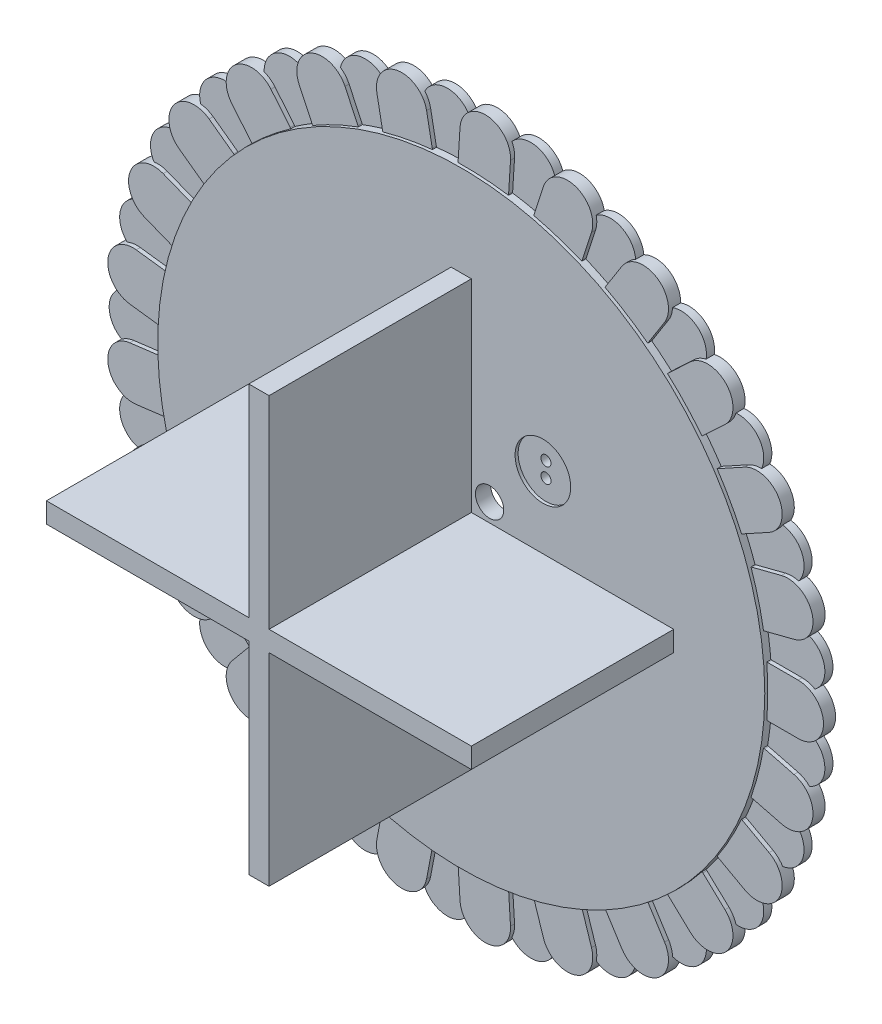
from build123d import *

# Parameters (mm, degrees)
SCHIZZO1_R                   = 30
ESTRUSIONE_ESTRUSIONE1_DEPTH = 1.5
ESTRUSIONE_ESTRUSIONE2_DEPTH = 20
SCHIZZO3_R                   = 0.5
TAGLIO_ESTRUSIONE1_DEPTH     = 47.904157598
SCHIZZO4_R                   = 2.75
TAGLIO_ESTRUSIONE2_DEPTH     = 0.3
ESTRUSIONE_ESTRUSIONE3_DEPTH = 0.8
ESTRUSIONE_ESTRUSIONE4_DEPTH = 1.2
SCHIZZO6_R                   = 1.4
TAGLIO_ESTRUSIONE3_DEPTH     = 54.998896887


with BuildPart() as part:
    # Schizzo1 → Estrusione-Estrusione1 (new body)
    with BuildSketch(Plane.XY):
        Circle(SCHIZZO1_R)
    extrude(amount=ESTRUSIONE_ESTRUSIONE1_DEPTH)

    # Schizzo2 → Estrusione-Estrusione2 (add)
    with BuildSketch(Plane.XY.offset(1.5)):
        Polygon((-1, 1), (-1, 21), (1, 21), (1, 1), (21, 1), (21, -1), (1, -1), (1, -21), (-1, -21), (-1, -1), (-21, -1), (-21, 1), align=None)
    extrude(amount=ESTRUSIONE_ESTRUSIONE2_DEPTH)

    # Schizzo3 → Taglio-Estrusione1 (cut, through all)
    with BuildSketch(Plane.XY.offset(1.5)):
        with Locations((-8.071067812, 8.821067812)):
            Circle(SCHIZZO3_R)
        with Locations((-8.071067812, 7.321067812)):
            Circle(SCHIZZO3_R)
        with Locations((-8.071067812, -8.821067812)):
            Circle(SCHIZZO3_R)
        with Locations((-8.071067812, -7.321067812)):
            Circle(SCHIZZO3_R)
        with Locations((8.071067812, -8.821067812)):
            Circle(SCHIZZO3_R)
        with Locations((8.071067812, -7.321067812)):
            Circle(SCHIZZO3_R)
        with Locations((8.071067812, 8.821067812)):
            Circle(SCHIZZO3_R)
        with Locations((8.071067812, 7.321067812)):
            Circle(SCHIZZO3_R)
    extrude(amount=-TAGLIO_ESTRUSIONE1_DEPTH, mode=Mode.SUBTRACT)

    # Schizzo4 → Taglio-Estrusione2 (cut)
    with BuildSketch(Plane.XY.offset(1.5)):
        with Locations((-8.071067812, -8.071067812)):
            Circle(SCHIZZO4_R)
        with Locations((8.071067812, -8.071067812)):
            Circle(SCHIZZO4_R)
        with Locations((8.071067812, 8.071067812)):
            Circle(SCHIZZO4_R)
        with Locations((-8.071067812, 8.071067812)):
            Circle(SCHIZZO4_R)
    extrude(amount=-TAGLIO_ESTRUSIONE2_DEPTH, mode=Mode.SUBTRACT)

    # Schizzo5 → Estrusione-Estrusione3 (add)
    with BuildSketch(Plane(origin=(0, 0, 0), x_dir=(-1, 0, 0), z_dir=(0, 0, -1))):
        with BuildLine():
            ThreePointArc((-29.895833333, -2.497828918), (-29.947905355, -2.499457171), (-30, -2.5))
            Line((-30, -2.5), (-33, -2.5))
            ThreePointArc((-33, -2.5), (-33.655910107, -2.41242242), (-34.265865799, -2.155825545))
            ThreePointArc((-34.265865799, -2.155825545), (-35.220071897, -4.449329792), (-33.725472626, -6.433477978))
            ThreePointArc((-33.725472626, -6.433477978), (-33.198492862, -6.033252754), (-32.584969035, -5.785308374))
            Line((-32.584969035, -5.785308374), (-29.679219552, -5.039238712))
            ThreePointArc((-29.679219552, -5.039238712), (-29.62862656, -5.026809076), (-29.577785546, -5.015436389))
            ThreePointArc((-29.577785546, -5.015436389), (-29.763441039, -3.759997007), (-29.895833333, -2.497828918))
        make_face()
        with BuildLine():
            ThreePointArc((-33.725472626, 6.433477978), (-35.220071897, 4.449329792), (-34.265865799, 2.155825545))
            ThreePointArc((-34.265865799, 2.155825545), (-33.655910107, 2.41242242), (-33, 2.5))
            Line((-33, 2.5), (-30, 2.5))
            ThreePointArc((-30, 2.5), (-29.947905355, 2.499457171), (-29.895833333, 2.497828918))
            ThreePointArc((-29.895833333, 2.497828918), (-29.763441039, 3.759997007), (-29.577785546, 5.015436389))
            ThreePointArc((-29.577785546, 5.015436389), (-29.62862656, 5.026809076), (-29.679219552, 5.039238712))
            Line((-29.679219552, 5.039238712), (-32.584969035, 5.785308374))
            ThreePointArc((-32.584969035, 5.785308374), (-33.198492862, 6.033252754), (-33.725472626, 6.433477978))
        make_face()
        with BuildLine():
            ThreePointArc((-31.341519599, -10.628224179), (-31.998602743, -10.70651622), (-32.653208603, -10.60967062))
            ThreePointArc((-32.653208603, -10.60967062), (-33.007065249, -13.06842162), (-31.065983974, -14.618542419))
            ThreePointArc((-31.065983974, -14.618542419), (-30.655092214, -14.099836468), (-30.122504627, -13.707104545))
            Line((-30.122504627, -13.707104545), (-27.493584587, -12.261843523))
            ThreePointArc((-27.493584587, -12.261843523), (-27.447672191, -12.237222421), (-27.401256714, -12.213563382))
            ThreePointArc((-27.401256714, -12.213563382), (-27.893294577, -11.043736581), (-28.335415963, -9.854146448))
            ThreePointArc((-28.335415963, -9.854146448), (-28.385447116, -9.868673331), (-28.435770116, -9.882154518))
            Line((-28.435770116, -9.882154518), (-31.341519599, -10.628224179))
        make_face()
        with BuildLine():
            ThreePointArc((-31.065983974, 14.618542419), (-33.007065249, 13.06842162), (-32.653208603, 10.60967062))
            ThreePointArc((-32.653208603, 10.60967062), (-31.998602743, 10.70651622), (-31.341519599, 10.628224179))
            Line((-31.341519599, 10.628224179), (-28.435770116, 9.882154518))
            ThreePointArc((-28.435770116, 9.882154518), (-28.385447116, 9.868673331), (-28.335415963, 9.854146448))
            ThreePointArc((-28.335415963, 9.854146448), (-27.893294577, 11.043736581), (-27.401256714, 12.213563382))
            ThreePointArc((-27.401256714, 12.213563382), (-27.447672191, 12.237222421), (-27.493584587, 12.261843523))
            Line((-27.493584587, 12.261843523), (-30.122504627, 13.707104545))
            ThreePointArc((-30.122504627, 13.707104545), (-30.655092214, 14.099836468), (-31.065983974, 14.618542419))
        make_face()
        with BuildLine():
            ThreePointArc((-27.713736256, -18.088637945), (-28.330705486, -18.327880231), (-28.98883022, -18.396871071))
            ThreePointArc((-28.98883022, -18.396871071), (-28.7201033, -20.866376456), (-26.454505296, -21.885070076))
            ThreePointArc((-26.454505296, -21.885070076), (-26.185519381, -21.280475601), (-25.76733247, -20.767632927))
            Line((-25.76733247, -20.767632927), (-23.580426587, -18.713991609))
            ThreePointArc((-23.580426587, -18.713991609), (-23.542079634, -18.678726077), (-23.503006148, -18.644267269))
            ThreePointArc((-23.503006148, -18.644267269), (-24.270509831, -17.633557569), (-24.994580197, -16.591291715))
            ThreePointArc((-24.994580197, -16.591291715), (-25.039426841, -16.617804452), (-25.084816216, -16.643376923))
            Line((-25.084816216, -16.643376923), (-27.713736256, -18.088637945))
        make_face()
        with BuildLine():
            ThreePointArc((-26.454505296, 21.885070076), (-28.7201033, 20.866376456), (-28.98883022, 18.396871071))
            ThreePointArc((-28.98883022, 18.396871071), (-28.330705486, 18.327880231), (-27.713736256, 18.088637945))
            Line((-27.713736256, 18.088637945), (-25.084816216, 16.643376923))
            ThreePointArc((-25.084816216, 16.643376923), (-25.039426841, 16.617804452), (-24.994580197, 16.591291715))
            ThreePointArc((-24.994580197, 16.591291715), (-24.270509831, 17.633557569), (-23.503006148, 18.644267269))
            ThreePointArc((-23.503006148, 18.644267269), (-23.542079634, 18.678726077), (-23.580426587, 18.713991609))
            Line((-23.580426587, 18.713991609), (-25.76733247, 20.767632927))
            ThreePointArc((-25.76733247, 20.767632927), (-26.185519381, 21.280475601), (-26.454505296, 21.885070076))
        make_face()
        with BuildLine():
            ThreePointArc((-22.34459694, -24.412476064), (-22.88268581, -24.797636121), (-23.502977021, -25.028128453))
            ThreePointArc((-23.502977021, -25.028128453), (-22.628551636, -27.353220119), (-20.180792758, -27.776478293))
            ThreePointArc((-20.180792758, -27.776478293), (-20.070614062, -27.123984189), (-19.793104048, -26.523254554))
            Line((-19.793104048, -26.523254554), (-18.185623663, -23.990270778))
            ThreePointArc((-18.185623663, -23.990270778), (-18.157251631, -23.946576677), (-18.127975267, -23.903483276))
            ThreePointArc((-18.127975267, -23.903483276), (-19.122719692, -23.115397283), (-20.083243033, -22.285945106))
            ThreePointArc((-20.083243033, -22.285945106), (-20.120087288, -22.322777803), (-20.157691058, -22.358834746))
            Line((-20.157691058, -22.358834746), (-22.34459694, -24.412476064))
        make_face()
        with BuildLine():
            ThreePointArc((-20.180792758, 27.776478293), (-22.628551636, 27.353220119), (-23.502977021, 25.028128453))
            ThreePointArc((-23.502977021, 25.028128453), (-22.88268581, 24.797636121), (-22.34459694, 24.412476064))
            Line((-22.34459694, 24.412476064), (-20.157691058, 22.358834746))
            ThreePointArc((-20.157691058, 22.358834746), (-20.120087288, 22.322777803), (-20.083243033, 22.285945106))
            ThreePointArc((-20.083243033, 22.285945106), (-19.122719692, 23.115397283), (-18.127975267, 23.903483276))
            ThreePointArc((-18.127975267, 23.903483276), (-18.157251631, 23.946576677), (-18.185623663, 23.990270778))
            Line((-18.185623663, 23.990270778), (-19.793104048, 26.523254554))
            ThreePointArc((-19.793104048, 26.523254554), (-20.070614062, 27.123984189), (-20.180792758, 27.776478293))
        make_face()
        with BuildLine():
            ThreePointArc((-15.571464421, -29.202388529), (-15.996862828, -29.709265335), (-16.540345338, -30.086776478))
            ThreePointArc((-16.540345338, -30.086776478), (-15.115164851, -32.121360363), (-12.639046791, -31.922588224))
            ThreePointArc((-12.639046791, -31.922588224), (-12.694598247, -31.263193094), (-12.575202105, -30.612322552))
            Line((-12.575202105, -30.612322552), (-11.648151122, -27.759153003))
            ThreePointArc((-11.648151122, -27.759153003), (-11.63153673, -27.709775795), (-11.61389703, -27.660755517))
            ThreePointArc((-11.61389703, -27.660755517), (-12.773378747, -27.144811574), (-13.910001849, -26.580290603))
            ThreePointArc((-13.910001849, -26.580290603), (-13.936528655, -26.625128927), (-13.963984036, -26.669404753))
            Line((-13.963984036, -26.669404753), (-15.571464421, -29.202388529))
        make_face()
        with BuildLine():
            ThreePointArc((-12.639046791, 31.922588224), (-15.115164851, 32.121360363), (-16.540345338, 30.086776478))
            ThreePointArc((-16.540345338, 30.086776478), (-15.996862828, 29.709265335), (-15.571464421, 29.202388529))
            Line((-15.571464421, 29.202388529), (-13.963984036, 26.669404753))
            ThreePointArc((-13.963984036, 26.669404753), (-13.936528655, 26.625128927), (-13.910001849, 26.580290603))
            ThreePointArc((-13.910001849, 26.580290603), (-12.773378747, 27.144811574), (-11.61389703, 27.660755517))
            ThreePointArc((-11.61389703, 27.660755517), (-11.63153673, 27.709775795), (-11.648151122, 27.759153003))
            Line((-11.648151122, 27.759153003), (-12.575202105, 30.612322552))
            ThreePointArc((-12.575202105, 30.612322552), (-12.694598247, 31.263193094), (-12.639046791, 31.922588224))
        make_face()
        with BuildLine():
            ThreePointArc((-7.819919524, -32.157407524), (-8.105898122, -32.754152145), (-8.538422926, -33.254961685))
            ThreePointArc((-8.538422926, -33.254961685), (-6.652036668, -34.871197401), (-4.303143031, -34.062884534))
            ThreePointArc((-4.303143031, -34.062884534), (-4.520934136, -33.4380206), (-4.567153966, -32.777905739))
            Line((-4.567153966, -32.777905739), (-4.378782407, -29.783825554))
            ThreePointArc((-4.378782407, -29.783825554), (-4.374969599, -29.731867791), (-4.37007493, -29.68000076))
            ThreePointArc((-4.37007493, -29.68000076), (-5.621439438, -29.468617522), (-6.862744092, -29.204498687))
            ThreePointArc((-6.862744092, -29.204498687), (-6.877286671, -29.25452528), (-6.892868541, -29.304237975))
            Line((-6.892868541, -29.304237975), (-7.819919524, -32.157407524))
        make_face()
        with BuildLine():
            ThreePointArc((-4.303143031, 34.062884534), (-6.652036668, 34.871197401), (-8.538422926, 33.254961685))
            ThreePointArc((-8.538422926, 33.254961685), (-8.105898122, 32.754152145), (-7.819919524, 32.157407524))
            Line((-7.819919524, 32.157407524), (-6.892868541, 29.304237975))
            ThreePointArc((-6.892868541, 29.304237975), (-6.877286671, 29.25452528), (-6.862744092, 29.204498687))
            ThreePointArc((-6.862744092, 29.204498687), (-5.621439438, 29.468617522), (-4.37007493, 29.68000076))
            ThreePointArc((-4.37007493, 29.68000076), (-4.374969599, 29.731867791), (-4.378782407, 29.783825554))
            Line((-4.378782407, 29.783825554), (-4.567153966, 32.777905739))
            ThreePointArc((-4.567153966, 32.777905739), (-4.520934136, 33.4380206), (-4.303143031, 34.062884534))
        make_face()
        with BuildLine():
            ThreePointArc((0.422979677, -33.091858337), (0.294389974, -33.740975114), (0, -34.333615346))
            ThreePointArc((0, -34.333615346), (2.229063443, -35.429948859), (4.303143031, -34.062884534))
            ThreePointArc((4.303143031, -34.062884534), (3.936796893, -33.511814294), (3.727865255, -32.883932561))
            Line((3.727865255, -32.883932561), (3.165721311, -29.937070808))
            ThreePointArc((3.165721311, -29.937070808), (3.156492962, -29.885797187), (3.14833505, -29.8343424))
            ThreePointArc((3.14833505, -29.8343424), (1.883715586, -29.940801853), (0.615725117, -29.993680711))
            ThreePointArc((0.615725117, -29.993680711), (0.614080527, -30.045752219), (0.611351235, -30.097778152))
            Line((0.611351235, -30.097778152), (0.422979677, -33.091858337))
        make_face()
        with BuildLine():
            ThreePointArc((4.303143031, 34.062884534), (2.229063443, 35.429948859), (0, 34.333615346))
            ThreePointArc((0, 34.333615346), (0.294389974, 33.740975114), (0.422979677, 33.091858337))
            Line((0.422979677, 33.091858337), (0.611351235, 30.097778152))
            ThreePointArc((0.611351235, 30.097778152), (0.614080527, 30.045752219), (0.615725117, 29.993680711))
            ThreePointArc((0.615725117, 29.993680711), (1.883715586, 29.940801853), (3.14833505, 29.8343424))
            ThreePointArc((3.14833505, 29.8343424), (3.156492962, 29.885797187), (3.165721311, 29.937070808))
            Line((3.165721311, 29.937070808), (3.727865255, 32.883932561))
            ThreePointArc((3.727865255, 32.883932561), (3.936796893, 33.511814294), (4.303143031, 34.062884534))
        make_face()
        with BuildLine():
            ThreePointArc((8.639301508, -31.947025988), (8.676180466, -32.607728526), (8.538422926, -33.254961685))
            ThreePointArc((8.538422926, -33.254961685), (10.9701033, -33.762506328), (12.639046791, -31.922588224))
            ThreePointArc((12.639046791, -31.922588224), (12.147164495, -31.479937449), (11.78864899, -30.92374096))
            Line((11.78864899, -30.92374096), (10.511311116, -28.209259803))
            ThreePointArc((10.511311116, -28.209259803), (10.489621462, -28.161892034), (10.46892356, -28.114082583))
            ThreePointArc((10.46892356, -28.114082583), (9.270509831, -28.531695489), (8.055506052, -28.898249467))
            ThreePointArc((8.055506052, -28.898249467), (8.066862787, -28.949094046), (8.077157564, -29.000164235))
            Line((8.077157564, -29.000164235), (8.639301508, -31.947025988))
        make_face()
        with BuildLine():
            ThreePointArc((12.639046791, 31.922588224), (10.9701033, 33.762506328), (8.538422926, 33.254961685))
            ThreePointArc((8.538422926, 33.254961685), (8.676180466, 32.607728526), (8.639301508, 31.947025988))
            Line((8.639301508, 31.947025988), (8.077157564, 29.000164235))
            ThreePointArc((8.077157564, 29.000164235), (8.066862787, 28.949094046), (8.055506052, 28.898249467))
            ThreePointArc((8.055506052, 28.898249467), (9.270509831, 28.531695489), (10.46892356, 28.114082583))
            ThreePointArc((10.46892356, 28.114082583), (10.489621462, 28.161892034), (10.511311116, 28.209259803))
            Line((10.511311116, 28.209259803), (11.78864899, 30.92374096))
            ThreePointArc((11.78864899, 30.92374096), (12.147164495, 31.479937449), (12.639046791, 31.922588224))
        make_face()
        with BuildLine():
            ThreePointArc((16.312784253, -28.794844502), (16.51281463, -29.425618432), (16.540345338, -30.086776478))
            ThreePointArc((16.540345338, -30.086776478), (19.021851222, -29.973641355), (20.180792758, -27.776478293))
            ThreePointArc((20.180792758, -27.776478293), (19.594281078, -27.470060359), (19.108708555, -27.020496986))
            Line((19.108708555, -27.020496986), (17.196436586, -24.708957258))
            ThreePointArc((17.196436586, -24.708957258), (17.163648466, -24.668471632), (17.1317111, -24.627311562))
            ThreePointArc((17.1317111, -24.627311562), (16.074803849, -25.329837765), (14.989129915, -25.987034929))
            ThreePointArc((14.989129915, -25.987034929), (15.012774391, -26.033457827), (15.035446378, -26.080363345))
            Line((15.035446378, -26.080363345), (16.312784253, -28.794844502))
        make_face()
        with BuildLine():
            ThreePointArc((20.180792758, 27.776478293), (19.021851222, 29.973641355), (16.540345338, 30.086776478))
            ThreePointArc((16.540345338, 30.086776478), (16.51281463, 29.425618432), (16.312784253, 28.794844502))
            Line((16.312784253, 28.794844502), (15.035446378, 26.080363345))
            ThreePointArc((15.035446378, 26.080363345), (15.012774391, 26.033457827), (14.989129915, 25.987034929))
            ThreePointArc((14.989129915, 25.987034929), (16.074803849, 25.329837765), (17.1317111, 24.627311562))
            ThreePointArc((17.1317111, 24.627311562), (17.163648466, 24.668471632), (17.196436586, 24.708957258))
            Line((17.196436586, 24.708957258), (19.108708555, 27.020496986))
            ThreePointArc((19.108708555, 27.020496986), (19.594281078, 27.470060359), (20.180792758, 27.776478293))
        make_face()
        with BuildLine():
            ThreePointArc((22.961274769, -23.833377037), (23.311887921, -24.394588512), (23.502977021, -25.028128453))
            ThreePointArc((23.502977021, -25.028128453), (25.878386273, -24.30142226), (26.454505296, -21.885070076))
            ThreePointArc((26.454505296, -21.885070076), (25.810216917, -21.734138349), (25.228097684, -21.419455812))
            Line((25.228097684, -21.419455812), (22.801046701, -19.656100055))
            ThreePointArc((22.801046701, -19.656100055), (22.759220315, -19.625040433), (22.718050227, -19.593115982))
            ThreePointArc((22.718050227, -19.593115982), (21.869058823, -20.536413178), (20.98093162, -21.442959412))
            ThreePointArc((20.98093162, -21.442959412), (21.015378166, -21.482043708), (21.049002799, -21.521837309))
            Line((21.049002799, -21.521837309), (22.961274769, -23.833377037))
        make_face()
        with BuildLine():
            ThreePointArc((26.454505296, 21.885070076), (25.878386273, 24.30142226), (23.502977021, 25.028128453))
            ThreePointArc((23.502977021, 25.028128453), (23.311887921, 24.394588512), (22.961274769, 23.833377037))
            Line((22.961274769, 23.833377037), (21.049002799, 21.521837309))
            ThreePointArc((21.049002799, 21.521837309), (21.015378166, 21.482043708), (20.98093162, 21.442959412))
            ThreePointArc((20.98093162, 21.442959412), (21.869058823, 20.536413178), (22.718050227, 19.593115982))
            ThreePointArc((22.718050227, 19.593115982), (22.759220315, 19.625040433), (22.801046701, 19.656100055))
            Line((22.801046701, 19.656100055), (25.228097684, 21.419455812))
            ThreePointArc((25.228097684, 21.419455812), (25.810216917, 21.734138349), (26.454505296, 21.885070076))
        make_face()
        with BuildLine():
            ThreePointArc((28.167023945, -17.37437084), (28.646189559, -17.830756878), (28.98883022, -18.396871071))
            ThreePointArc((28.98883022, -18.396871071), (31.108887142, -17.102255431), (31.065983974, -14.618542419))
            ThreePointArc((31.065983974, -14.618542419), (30.404401905, -14.632580493), (29.762312653, -14.472551453))
            Line((29.762312653, -14.472551453), (26.972983195, -13.368177795))
            ThreePointArc((26.972983195, -13.368177795), (26.924746648, -13.348495768), (26.876930706, -13.327812867))
            ThreePointArc((26.876930706, -13.327812867), (26.289200401, -14.452610223), (25.654424229, -15.551543894))
            ThreePointArc((25.654424229, -15.551543894), (25.697508442, -15.580833777), (25.739972962, -15.611015083))
            Line((25.739972962, -15.611015083), (28.167023945, -17.37437084))
        make_face()
        with BuildLine():
            ThreePointArc((31.065983974, 14.618542419), (31.108887142, 17.102255431), (28.98883022, 18.396871071))
            ThreePointArc((28.98883022, 18.396871071), (28.646189559, 17.830756878), (28.167023945, 17.37437084))
            Line((28.167023945, 17.37437084), (25.739972962, 15.611015083))
            ThreePointArc((25.739972962, 15.611015083), (25.697508442, 15.580833777), (25.654424229, 15.551543894))
            ThreePointArc((25.654424229, 15.551543894), (26.289200401, 14.452610223), (26.876930706, 13.327812867))
            ThreePointArc((26.876930706, 13.327812867), (26.924746648, 13.348495768), (26.972983195, 13.368177795))
            Line((26.972983195, 13.368177795), (29.762312653, 14.472551453))
            ThreePointArc((29.762312653, 14.472551453), (30.404401905, 14.632580493), (31.065983974, 14.618542419))
        make_face()
        with BuildLine():
            ThreePointArc((31.602935416, -9.823669024), (32.180545753, -10.146553214), (32.653208603, -10.60967062))
            ThreePointArc((32.653208603, -10.60967062), (34.38470222, -8.828490994), (33.725472626, -6.433477978))
            ThreePointArc((33.725472626, -6.433477978), (33.088166501, -6.611603791), (32.426452059, -6.616283461))
            Line((32.426452059, -6.616283461), (29.450107956, -6.24028376))
            ThreePointArc((29.450107956, -6.24028376), (29.398492127, -6.233216021), (29.347034783, -6.225074253))
            ThreePointArc((29.347034783, -6.225074253), (29.057494834, -7.460696615), (28.715955013, -8.682967679))
            ThreePointArc((28.715955013, -8.682967679), (28.764969754, -8.700622758), (28.813605958, -8.719295366))
            Line((28.813605958, -8.719295366), (31.602935416, -9.823669024))
        make_face()
        with BuildLine():
            ThreePointArc((33.725472626, 6.433477978), (34.38470222, 8.828490994), (32.653208603, 10.60967062))
            ThreePointArc((32.653208603, 10.60967062), (32.180545753, 10.146553214), (31.602935416, 9.823669024))
            Line((31.602935416, 9.823669024), (28.813605958, 8.719295366))
            ThreePointArc((28.813605958, 8.719295366), (28.764969754, 8.700622758), (28.715955013, 8.682967679))
            ThreePointArc((28.715955013, 8.682967679), (29.057494834, 7.460696615), (29.347034783, 6.225074253))
            ThreePointArc((29.347034783, 6.225074253), (29.398492127, 6.233216021), (29.450107956, 6.24028376))
            Line((29.450107956, 6.24028376), (32.426452059, 6.616283461))
            ThreePointArc((32.426452059, 6.616283461), (33.088166501, 6.611603791), (33.725472626, 6.433477978))
        make_face()
        with BuildLine():
            ThreePointArc((33.053118227, -1.655709954), (33.692879906, -1.824804294), (34.265865799, -2.155825545))
            ThreePointArc((34.265865799, -2.155825545), (35.5, 0), (34.265865799, 2.155825545))
            ThreePointArc((34.265865799, 2.155825545), (33.692879906, 1.824804294), (33.053118227, 1.655709954))
            Line((33.053118227, 1.655709954), (30.076774123, 1.279710254))
            ThreePointArc((30.076774123, 1.279710254), (30.025022226, 1.273719612), (29.973156733, 1.26880867))
            ThreePointArc((29.973156733, 1.26880867), (30, 0), (29.973156733, -1.26880867))
            ThreePointArc((29.973156733, -1.26880867), (30.025022226, -1.273719612), (30.076774123, -1.279710254))
            Line((30.076774123, -1.279710254), (33.053118227, -1.655709954))
        make_face()
    extrude(amount=-ESTRUSIONE_ESTRUSIONE3_DEPTH)

    # Schizzo5<3> → Estrusione-Estrusione4 (add)
    with BuildSketch(Plane(origin=(0, 0, 0), x_dir=(-1, 0, 0), z_dir=(0, 0, -1))):
        with BuildLine():
            Line((-30, -2.5), (-33, -2.5))
            ThreePointArc((-33, -2.5), (-35.5, 0), (-33, 2.5))
            Line((-33, 2.5), (-30, 2.5))
            ThreePointArc((-30, 2.5), (-27.5, 0), (-30, -2.5))
        make_face()
        with BuildLine():
            Line((-28.435770116, 9.882154518), (-31.341519599, 10.628224179))
            ThreePointArc((-31.341519599, 10.628224179), (-34.38470222, 8.828490994), (-32.584969035, 5.785308374))
            Line((-32.584969035, 5.785308374), (-29.679219552, 5.039238712))
            ThreePointArc((-29.679219552, 5.039238712), (-26.636036931, 6.838971897), (-28.435770116, 9.882154518))
        make_face()
        with BuildLine():
            Line((-25.084816216, 16.643376923), (-27.713736256, 18.088637945))
            ThreePointArc((-27.713736256, 18.088637945), (-31.108887142, 17.102255431), (-30.122504627, 13.707104545))
            Line((-30.122504627, 13.707104545), (-27.493584587, 12.261843523))
            ThreePointArc((-27.493584587, 12.261843523), (-24.098433701, 13.248226038), (-25.084816216, 16.643376923))
        make_face()
        with BuildLine():
            Line((-20.157691058, 22.358834746), (-22.34459694, 24.412476064))
            ThreePointArc((-22.34459694, 24.412476064), (-25.878386273, 24.30142226), (-25.76733247, 20.767632927))
            Line((-25.76733247, 20.767632927), (-23.580426587, 18.713991609))
            ThreePointArc((-23.580426587, 18.713991609), (-20.046637254, 18.825045413), (-20.157691058, 22.358834746))
        make_face()
        with BuildLine():
            Line((-13.963984036, 26.669404753), (-15.571464421, 29.202388529))
            ThreePointArc((-15.571464421, 29.202388529), (-19.021851222, 29.973641355), (-19.793104048, 26.523254554))
            Line((-19.793104048, 26.523254554), (-18.185623663, 23.990270778))
            ThreePointArc((-18.185623663, 23.990270778), (-14.735236862, 23.219017951), (-13.963984036, 26.669404753))
        make_face()
        with BuildLine():
            Line((-6.892868541, 29.304237975), (-7.819919524, 32.157407524))
            ThreePointArc((-7.819919524, 32.157407524), (-10.9701033, 33.762506328), (-12.575202105, 30.612322552))
            Line((-12.575202105, 30.612322552), (-11.648151122, 27.759153003))
            ThreePointArc((-11.648151122, 27.759153003), (-8.497967345, 26.154054198), (-6.892868541, 29.304237975))
        make_face()
        with BuildLine():
            Line((0.611351235, 30.097778152), (0.422979677, 33.091858337))
            ThreePointArc((0.422979677, 33.091858337), (-2.229063443, 35.429948859), (-4.567153966, 32.777905739))
            Line((-4.567153966, 32.777905739), (-4.378782407, 29.783825554))
            ThreePointArc((-4.378782407, 29.783825554), (-1.726739287, 27.445735032), (0.611351235, 30.097778152))
        make_face()
        with BuildLine():
            Line((8.077157564, 29.000164235), (8.639301508, 31.947025988))
            ThreePointArc((8.639301508, 31.947025988), (6.652036668, 34.871197401), (3.727865255, 32.883932561))
            Line((3.727865255, 32.883932561), (3.165721311, 29.937070808))
            ThreePointArc((3.165721311, 29.937070808), (5.152986151, 27.012899395), (8.077157564, 29.000164235))
        make_face()
        with BuildLine():
            Line((15.035446378, 26.080363345), (16.312784253, 28.794844502))
            ThreePointArc((16.312784253, 28.794844502), (15.115164851, 32.121360363), (11.78864899, 30.92374096))
            Line((11.78864899, 30.92374096), (10.511311116, 28.209259803))
            ThreePointArc((10.511311116, 28.209259803), (11.708930518, 24.882743943), (15.035446378, 26.080363345))
        make_face()
        with BuildLine():
            Line((21.049002799, 21.521837309), (22.961274769, 23.833377037))
            ThreePointArc((22.961274769, 23.833377037), (22.628551636, 27.353220119), (19.108708555, 27.020496986))
            Line((19.108708555, 27.020496986), (17.196436586, 24.708957258))
            ThreePointArc((17.196436586, 24.708957258), (17.529159718, 21.189114176), (21.049002799, 21.521837309))
        make_face()
        with BuildLine():
            Line((25.739972962, 15.611015083), (28.167023945, 17.37437084))
            ThreePointArc((28.167023945, 17.37437084), (28.7201033, 20.866376456), (25.228097684, 21.419455812))
            Line((25.228097684, 21.419455812), (22.801046701, 19.656100055))
            ThreePointArc((22.801046701, 19.656100055), (22.247967345, 16.164094438), (25.739972962, 15.611015083))
        make_face()
        with BuildLine():
            Line((28.813605958, 8.719295366), (31.602935416, 9.823669024))
            ThreePointArc((31.602935416, 9.823669024), (33.007065249, 13.06842162), (29.762312653, 14.472551453))
            Line((29.762312653, 14.472551453), (26.972983195, 13.368177795))
            ThreePointArc((26.972983195, 13.368177795), (25.568853362, 10.123425199), (28.813605958, 8.719295366))
        make_face()
        with BuildLine():
            Line((30.076774123, 1.279710254), (33.053118227, 1.655709954))
            ThreePointArc((33.053118227, 1.655709954), (35.220071897, 4.449329792), (32.426452059, 6.616283461))
            Line((32.426452059, 6.616283461), (29.450107956, 6.24028376))
            ThreePointArc((29.450107956, 6.24028376), (27.283154286, 3.446663923), (30.076774123, 1.279710254))
        make_face()
        with BuildLine():
            Line((29.450107956, -6.24028376), (32.426452059, -6.616283461))
            ThreePointArc((32.426452059, -6.616283461), (35.220071897, -4.449329792), (33.053118227, -1.655709954))
            Line((33.053118227, -1.655709954), (30.076774123, -1.279710254))
            ThreePointArc((30.076774123, -1.279710254), (27.283154286, -3.446663923), (29.450107956, -6.24028376))
        make_face()
        with BuildLine():
            Line((26.972983195, -13.368177795), (29.762312653, -14.472551453))
            ThreePointArc((29.762312653, -14.472551453), (33.007065249, -13.06842162), (31.602935416, -9.823669024))
            Line((31.602935416, -9.823669024), (28.813605958, -8.719295366))
            ThreePointArc((28.813605958, -8.719295366), (25.568853362, -10.123425199), (26.972983195, -13.368177795))
        make_face()
        with BuildLine():
            Line((22.801046701, -19.656100055), (25.228097684, -21.419455812))
            ThreePointArc((25.228097684, -21.419455812), (28.7201033, -20.866376456), (28.167023945, -17.37437084))
            Line((28.167023945, -17.37437084), (25.739972962, -15.611015083))
            ThreePointArc((25.739972962, -15.611015083), (22.247967345, -16.164094438), (22.801046701, -19.656100055))
        make_face()
        with BuildLine():
            Line((17.196436586, -24.708957258), (19.108708555, -27.020496986))
            ThreePointArc((19.108708555, -27.020496986), (22.628551636, -27.353220119), (22.961274769, -23.833377037))
            Line((22.961274769, -23.833377037), (21.049002799, -21.521837309))
            ThreePointArc((21.049002799, -21.521837309), (17.529159718, -21.189114176), (17.196436586, -24.708957258))
        make_face()
        with BuildLine():
            Line((10.511311116, -28.209259803), (11.78864899, -30.92374096))
            ThreePointArc((11.78864899, -30.92374096), (15.115164851, -32.121360363), (16.312784253, -28.794844502))
            Line((16.312784253, -28.794844502), (15.035446378, -26.080363345))
            ThreePointArc((15.035446378, -26.080363345), (11.708930518, -24.882743943), (10.511311116, -28.209259803))
        make_face()
        with BuildLine():
            Line((3.165721311, -29.937070808), (3.727865255, -32.883932561))
            ThreePointArc((3.727865255, -32.883932561), (6.652036668, -34.871197401), (8.639301508, -31.947025988))
            Line((8.639301508, -31.947025988), (8.077157564, -29.000164235))
            ThreePointArc((8.077157564, -29.000164235), (5.152986151, -27.012899395), (3.165721311, -29.937070808))
        make_face()
        with BuildLine():
            Line((-4.378782407, -29.783825554), (-4.567153966, -32.777905739))
            ThreePointArc((-4.567153966, -32.777905739), (-2.229063443, -35.429948859), (0.422979677, -33.091858337))
            Line((0.422979677, -33.091858337), (0.611351235, -30.097778152))
            ThreePointArc((0.611351235, -30.097778152), (-1.726739287, -27.445735032), (-4.378782407, -29.783825554))
        make_face()
        with BuildLine():
            Line((-11.648151122, -27.759153003), (-12.575202105, -30.612322552))
            ThreePointArc((-12.575202105, -30.612322552), (-10.9701033, -33.762506328), (-7.819919524, -32.157407524))
            Line((-7.819919524, -32.157407524), (-6.892868541, -29.304237975))
            ThreePointArc((-6.892868541, -29.304237975), (-8.497967345, -26.154054198), (-11.648151122, -27.759153003))
        make_face()
        with BuildLine():
            Line((-18.185623663, -23.990270778), (-19.793104048, -26.523254554))
            ThreePointArc((-19.793104048, -26.523254554), (-19.021851222, -29.973641355), (-15.571464421, -29.202388529))
            Line((-15.571464421, -29.202388529), (-13.963984036, -26.669404753))
            ThreePointArc((-13.963984036, -26.669404753), (-14.735236862, -23.219017951), (-18.185623663, -23.990270778))
        make_face()
        with BuildLine():
            Line((-23.580426587, -18.713991609), (-25.76733247, -20.767632927))
            ThreePointArc((-25.76733247, -20.767632927), (-25.878386273, -24.30142226), (-22.34459694, -24.412476064))
            Line((-22.34459694, -24.412476064), (-20.157691058, -22.358834746))
            ThreePointArc((-20.157691058, -22.358834746), (-20.046637254, -18.825045413), (-23.580426587, -18.713991609))
        make_face()
        with BuildLine():
            Line((-27.493584587, -12.261843523), (-30.122504627, -13.707104545))
            ThreePointArc((-30.122504627, -13.707104545), (-31.108887142, -17.102255431), (-27.713736256, -18.088637945))
            Line((-27.713736256, -18.088637945), (-25.084816216, -16.643376923))
            ThreePointArc((-25.084816216, -16.643376923), (-24.098433701, -13.248226038), (-27.493584587, -12.261843523))
        make_face()
        with BuildLine():
            Line((-29.679219552, -5.039238712), (-32.584969035, -5.785308374))
            ThreePointArc((-32.584969035, -5.785308374), (-34.38470222, -8.828490994), (-31.341519599, -10.628224179))
            Line((-31.341519599, -10.628224179), (-28.435770116, -9.882154518))
            ThreePointArc((-28.435770116, -9.882154518), (-26.636036931, -6.838971897), (-29.679219552, -5.039238712))
        make_face()
    extrude(amount=-ESTRUSIONE_ESTRUSIONE4_DEPTH)

    # Schizzo6 → Taglio-Estrusione3 (cut, through all)
    with BuildSketch(Plane.XY.offset(1.5)):
        with Locations((-2.8, 2.8)):
            Circle(SCHIZZO6_R)
        with Locations((-2.8, -2.8)):
            Circle(SCHIZZO6_R)
        with Locations((2.8, -2.8)):
            Circle(SCHIZZO6_R)
        with Locations((2.8, 2.8)):
            Circle(SCHIZZO6_R)
    extrude(amount=-TAGLIO_ESTRUSIONE3_DEPTH, mode=Mode.SUBTRACT)


solid = part.part
